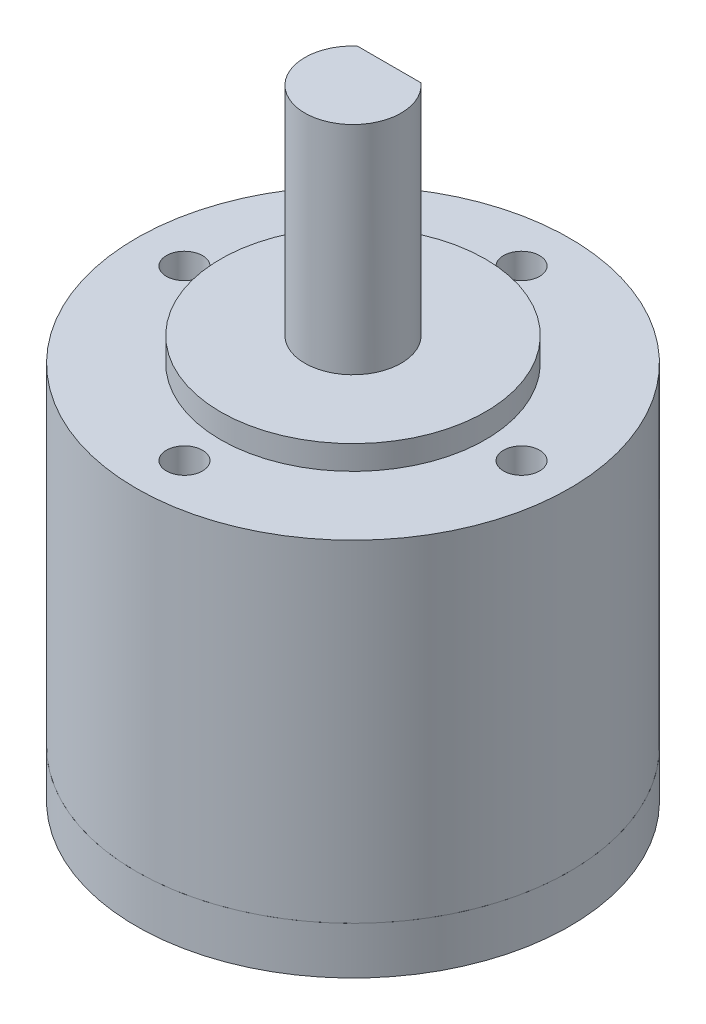
from build123d import *

# Parameters (mm, degrees)
SKETCH1_R           = 18
BOSS_EXTRUDE1_DEPTH = 13.7795
SKETCH2_R           = 11
BOSS_EXTRUDE2_DEPTH = 2
SKETCH3_R           = 4
BOSS_EXTRUDE4_DEPTH = 18
CUT_EXTRUDE1_START  = -15
CUT_EXTRUDE1_DEPTH  = 15
SKETCH5_R           = 1.5
CUT_EXTRUDE2_DEPTH  = 38.51664272
SKETCH6_R           = 11.178
CUT_EXTRUDE3_DEPTH  = 20
SKETCH7_R           = 18
BOSS_EXTRUDE5_DEPTH = 3.937
SKETCH8_R           = 10.9855
BOSS_EXTRUDE6_DEPTH = 2.413
SKETCH9_R           = 1.265
CUT_EXTRUDE4_DEPTH  = 54.94310411
SKETCH10_R          = 4
CUT_EXTRUDE5_DEPTH  = 52.82819036
SKETCH11_R          = 4.75
CUT_EXTRUDE6_DEPTH  = 0.6


with BuildPart() as part:
    # Sketch1 → Boss-Extrude1 (new, symmetric)
    with BuildSketch(Plane(origin=(0, 0, 0), x_dir=(1, 0, 0), z_dir=(0, 1, 0))):
        Circle(SKETCH1_R)
    extrude(amount=BOSS_EXTRUDE1_DEPTH, both=True)

    # Sketch2 → Boss-Extrude2 (add)
    with BuildSketch(Plane(origin=(0, 13.7795, 0), x_dir=(1, 0, 0), z_dir=(0, 1, 0))):
        Circle(SKETCH2_R)
    extrude(amount=BOSS_EXTRUDE2_DEPTH)

    # Sketch3 → Boss-Extrude4 (add)
    with BuildSketch(Plane(origin=(0, 15.7795, 0), x_dir=(1, 0, 0), z_dir=(0, 1, 0))):
        Circle(SKETCH3_R)
    extrude(amount=BOSS_EXTRUDE4_DEPTH)

    # Sketch4 → Cut-Extrude1 (cut)
    with BuildSketch(Plane(origin=(0, 33.7795, 0), x_dir=(1, 0, 0), z_dir=(0, 1, 0)).offset(CUT_EXTRUDE1_START)):
        with BuildLine():
            Line((-2.645751311, 3), (2.645751311, 3))
            ThreePointArc((2.645751311, 3), (0, 4), (-2.645751311, 3))
        make_face()
    extrude(amount=CUT_EXTRUDE1_DEPTH, mode=Mode.SUBTRACT)

    # Sketch5 → Cut-Extrude2 (cut, through all)
    with BuildSketch(Plane(origin=(0, 13.7795, 0), x_dir=(1, 0, 0), z_dir=(0, 1, 0))):
        with Locations((0, 14)):
            Circle(SKETCH5_R)
        with Locations((-14, 0)):
            Circle(SKETCH5_R)
        with Locations((0, -14)):
            Circle(SKETCH5_R)
        with Locations((14, 0)):
            Circle(SKETCH5_R)
    extrude(amount=-CUT_EXTRUDE2_DEPTH, mode=Mode.SUBTRACT)

    # Sketch6 → Cut-Extrude3 (cut)
    with BuildSketch(Plane.XZ.offset(13.7795)):
        Circle(SKETCH6_R)
    extrude(amount=-CUT_EXTRUDE3_DEPTH, mode=Mode.SUBTRACT)


with BuildPart() as body_2:
    # Sketch7 → Boss-Extrude5 (new body)
    with BuildSketch(Plane.XZ.offset(13.7795)):
        Circle(SKETCH7_R)
    extrude(amount=BOSS_EXTRUDE5_DEPTH)

    # Sketch8 → Boss-Extrude6 (add)
    with BuildSketch(Plane(origin=(0, -13.7795, 0), x_dir=(1, 0, 0), z_dir=(0, 1, 0))):
        Circle(SKETCH8_R)
    extrude(amount=BOSS_EXTRUDE6_DEPTH)

    # Sketch9 → Cut-Extrude4 (cut, through all)
    with BuildSketch(Plane(origin=(0, -13.7795, 0), x_dir=(1, 0, 0), z_dir=(0, 1, 0))):
        with Locations((0, 14)):
            Circle(SKETCH9_R)
        with Locations((14, 0)):
            Circle(SKETCH9_R)
        with Locations((0, -14)):
            Circle(SKETCH9_R)
        with Locations((-14, 0)):
            Circle(SKETCH9_R)
    extrude(amount=-CUT_EXTRUDE4_DEPTH, mode=Mode.SUBTRACT)

    # Sketch10 → Cut-Extrude5 (cut, through all)
    with BuildSketch(Plane(origin=(0, -11.3665, 0), x_dir=(1, 0, 0), z_dir=(0, 1, 0))):
        Circle(SKETCH10_R)
    extrude(amount=-CUT_EXTRUDE5_DEPTH, mode=Mode.SUBTRACT)

    # Sketch11 → Cut-Extrude6 (cut)
    with BuildSketch(Plane(origin=(0, -11.3665, 0), x_dir=(1, 0, 0), z_dir=(0, 1, 0))):
        Circle(SKETCH11_R)
    extrude(amount=-CUT_EXTRUDE6_DEPTH, mode=Mode.SUBTRACT)


solid = Compound([part.part, body_2.part])
